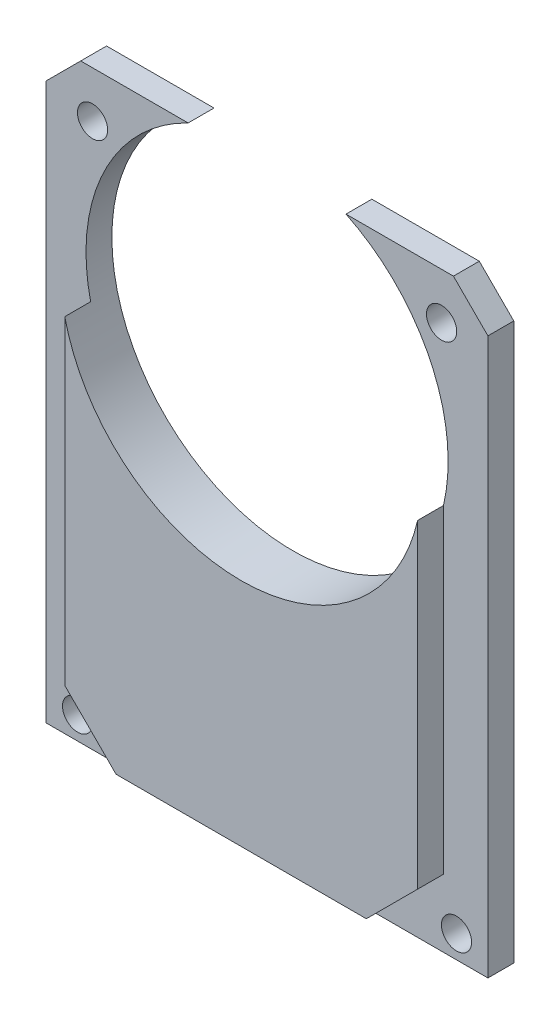
from build123d import *

# Parameters (mm, degrees)
SKETCH1_W           = 51.23
SKETCH1_H           = 68.5
BOSS_EXTRUDE1_DEPTH = 3
CHAMFER1_SIZE       = 4
SKETCH3_W           = 40.93
SKETCH3_H           = 61.5
BOSS_EXTRUDE3_DEPTH = 3
CHAMFER2_SIZE       = 5.95
SKETCH4_R           = 1.75
CUT_EXTRUDE1_DEPTH  = 43.874126522
SKETCH5_R           = 21
CUT_EXTRUDE2_DEPTH  = 44.187853906
CUT_EXTRUDE3_DEPTH  = 10
CUT_EXTRUDE4_DEPTH  = 10


with BuildPart() as part:
    # Sketch1 → Boss-Extrude1 (new body)
    with BuildSketch(Plane.XY):
        Rectangle(SKETCH1_W, SKETCH1_H)
    extrude(amount=BOSS_EXTRUDE1_DEPTH)

    # Chamfer1
    chamfer1_edges = [part.edges().sort_by_distance(p)[0] for p in [
        (25.615, 34.25, 1.5),
        (-25.615, 34.25, 1.5),
    ]]
    chamfer(chamfer1_edges, length=CHAMFER1_SIZE)

    # Sketch3 → Boss-Extrude3 (add)
    with BuildSketch(Plane.XY.offset(3)):
        with Locations((0, -1.6)):
            Rectangle(SKETCH3_W, SKETCH3_H)
    extrude(amount=BOSS_EXTRUDE3_DEPTH)

    # Chamfer2
    chamfer2_edges = [part.edges().sort_by_distance(p)[0] for p in [
        (20.465, -32.35, 4.5),
        (-20.465, -32.35, 4.5),
        (-20.465, 29.15, 4.5),
        (20.465, 29.15, 4.5),
    ]]
    chamfer(chamfer2_edges, length=CHAMFER2_SIZE)

    # Sketch4 → Cut-Extrude1 (cut, through all)
    with BuildSketch(Plane.XY.offset(3)):
        with Locations((-20.242100654, 28.877100654)):
            Circle(SKETCH4_R)
        with Locations((20.242100654, 28.877100654)):
            Circle(SKETCH4_R)
        with Locations((21.974423525, -31.604966365)):
            Circle(SKETCH4_R)
        with Locations((-21.974423525, -31.604966365)):
            Circle(SKETCH4_R)
    extrude(amount=-CUT_EXTRUDE1_DEPTH, mode=Mode.SUBTRACT)

    # Sketch5 → Cut-Extrude2 (cut, through all)
    with BuildSketch(Plane(origin=(0, 0, 0), x_dir=(-1, 0, 0), z_dir=(0, 0, -1))):
        with Locations((0, 15.35)):
            Circle(SKETCH5_R)
    extrude(amount=-CUT_EXTRUDE2_DEPTH, mode=Mode.SUBTRACT)

    # Sketch6 → Cut-Extrude3 (cut)
    with BuildSketch(Plane.ZY.offset(20.465)):
        Polygon((6, 20.059965499), (3, 20.059965499), (3, 23.2), (3, 26.692012581), (6, 26.692012581), (6, 23.2), align=None)
    extrude(amount=-CUT_EXTRUDE3_DEPTH, mode=Mode.SUBTRACT)

    # Sketch7 → Cut-Extrude4 (cut)
    with BuildSketch(Plane(origin=(20.465, 0, 0), x_dir=(0, 0, -1), z_dir=(1, 0, 0))):
        Polygon((-6, 20.059965499), (-3, 20.059965499), (-3, 23.2), (-3, 26.501776521), (-6, 26.501776521), (-6, 23.2), align=None)
    extrude(amount=-CUT_EXTRUDE4_DEPTH, mode=Mode.SUBTRACT)


solid = part.part
